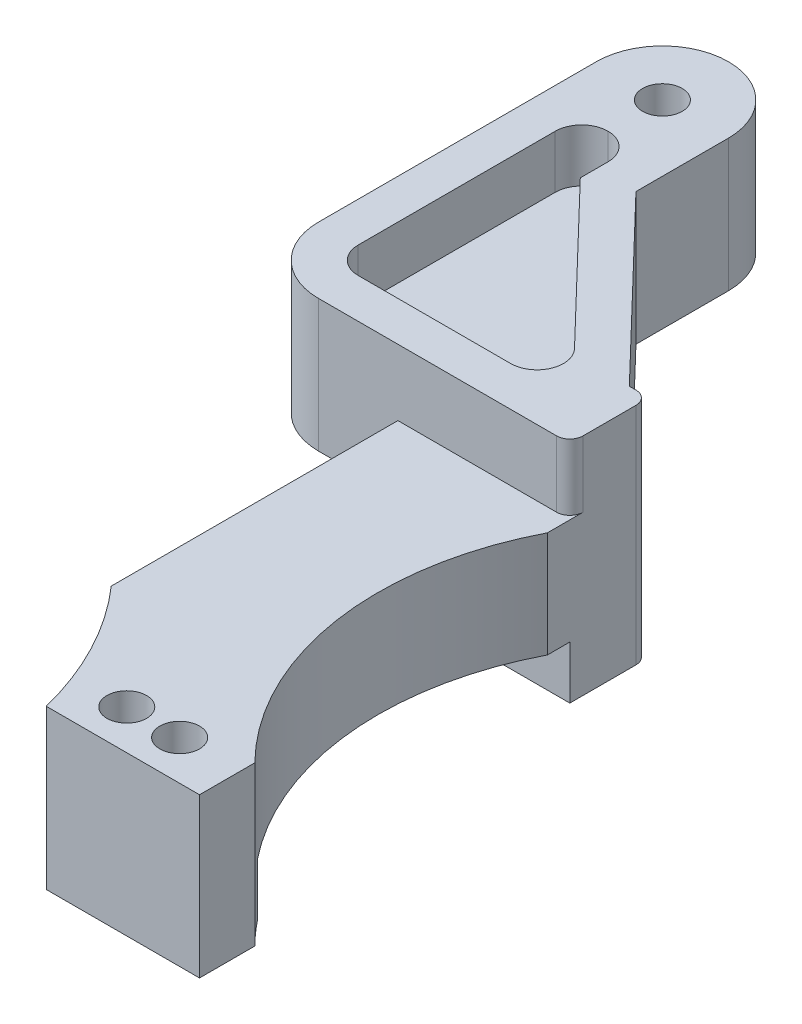
from build123d import *

# Parameters (mm, degrees)
SKETCH1_W             = 13
SKETCH1_H             = 6
SKETCH1_R             = 1.5
BOSS_EXTRUDE1_DEPTH   = 4
BOSS_EXTRUDE1_2_DEPTH = 4
BOSS_EXTRUDE2_START   = 4
SKETCH1_4_R           = 1.5
SKETCH1_4_W           = 13
SKETCH1_4_H           = 6
BOSS_EXTRUDE2_DEPTH   = 8
SKETCH2_R             = 1.5
BOSS_EXTRUDE3_DEPTH   = 5
BOSS_EXTRUDE4_START   = -5
SKETCH2_3_R           = 1.5
BOSS_EXTRUDE4_DEPTH   = 5
CUT_EXTRUDE1_DEPTH    = 4
FILLET1_R             = 1
FILLET2_R             = 1
FILLET3_R             = 2
BOSS_EXTRUDE5_START   = 11
SKETCH4_R             = 1.5
BOSS_EXTRUDE5_DEPTH   = 11


with BuildPart() as part:
    # Sketch1 → Boss-Extrude1 (new body)
    with BuildSketch(Plane(origin=(0, -9, 0), x_dir=(1, 0, 0), z_dir=(0, 1, 0))):
        with Locations((25.1, 41)):
            Rectangle(SKETCH1_W, SKETCH1_H)
        with Locations(Location((27.1, 41, 0), (0, 0, 270))):
            Circle(SKETCH1_R, mode=Mode.SUBTRACT)
        with Locations(Location((23.1, 41, 0), (0, 0, 270))):
            Circle(SKETCH1_R, mode=Mode.SUBTRACT)
    extrude(amount=BOSS_EXTRUDE1_DEPTH)



with BuildPart() as body_2:
    # Sketch1 → Boss-Extrude1 2 (new body)
    with BuildSketch(Plane(origin=(0, -9, 0), x_dir=(1, 0, 0), z_dir=(0, 1, 0))):
        with BuildLine():
            ThreePointArc((22.6, 10.089722494), (23.395394249, 8.075767946), (24.01171589, 6))
            Line((24.01171589, 6), (35.6, 6))
            Line((35.6, 6), (35.6, 10.18070798))
            ThreePointArc((35.6, 10.18070798), (34.768444056, 11.068532406), (33.986085046, 12))
            Line((33.986085046, 12), (31.6, 12))
            Line((31.6, 12), (22.6, 12))
            Line((22.6, 12), (22.6, 10.089722494))
        make_face()
        with Locations(Location((27.1, 9, 0), (0, 0, 270))):
            Circle(SKETCH1_R, mode=Mode.SUBTRACT)
        with Locations(Location((31.1, 9, 0), (0, 0, 270))):
            Circle(SKETCH1_R, mode=Mode.SUBTRACT)
    extrude(amount=BOSS_EXTRUDE1_2_DEPTH)


with BuildPart() as part_1:
    add(part.part)

    add(body_2.part)  # Boss-Extrude2 merges body 2
    # Sketch1<4> → Boss-Extrude2 (add)
    # profile 1 of 5: a face of its own
    with BuildSketch(Plane(origin=(0, -9, 0), x_dir=(1, 0, 0), z_dir=(0, 1, 0)).offset(BOSS_EXTRUDE2_START)):
        with BuildLine():
            ThreePointArc((22.6, 10.089722494), (23.395394249, 8.075767946), (24.01171589, 6))
            Line((24.01171589, 6), (35.6, 6))
            Line((35.6, 6), (35.6, 10.18070798))
            ThreePointArc((35.6, 10.18070798), (34.768444056, 11.068532406), (33.986085046, 12))
            Line((33.986085046, 12), (31.6, 12))
            Line((31.6, 12), (22.6, 12))
            Line((22.6, 12), (22.6, 10.089722494))
        make_face()
        with Locations(Location((27.1, 9, 0), (0, 0, 270))):
            Circle(SKETCH1_4_R, mode=Mode.SUBTRACT)
        with Locations(Location((31.1, 9, 0), (0, 0, 270))):
            Circle(SKETCH1_4_R, mode=Mode.SUBTRACT)
    # profile 2 of 5: a face of its own
    with BuildSketch(Plane(origin=(0, -9, 0), x_dir=(1, 0, 0), z_dir=(0, 1, 0)).offset(BOSS_EXTRUDE2_START)):
        with BuildLine():
            Line((21.646304534, 12), (22.6, 12))
            Line((22.6, 12), (31.6, 12))
            Line((31.6, 12), (31.6, 15.692235936))
            ThreePointArc((31.6, 15.692235936), (29.1, 26), (31.6, 36.307764064))
            Line((31.6, 36.307764064), (31.6, 38))
            Line((31.6, 38), (18.6, 38))
            Line((18.6, 38), (18.6, 16.327966805))
            ThreePointArc((18.6, 16.327966805), (20.239171953, 14.245645604), (21.646304534, 12))
        make_face()
    # profile 3 of 5: a face of its own
    with BuildSketch(Plane(origin=(0, -9, 0), x_dir=(1, 0, 0), z_dir=(0, 1, 0)).offset(BOSS_EXTRUDE2_START)):
        with BuildLine():
            Line((31.6, 15.692235936), (31.6, 12))
            Line((31.6, 12), (33.986085046, 12))
            ThreePointArc((33.986085046, 12), (32.702650951, 13.787702963), (31.6, 15.692235936))
        make_face()
    # profile 4 of 5: a face of its own
    with BuildSketch(Plane(origin=(0, -9, 0), x_dir=(1, 0, 0), z_dir=(0, 1, 0)).offset(BOSS_EXTRUDE2_START)):
        with BuildLine():
            ThreePointArc((21.646304534, 12), (22.143761114, 11.055150099), (22.6, 10.089722494))
            Line((22.6, 10.089722494), (22.6, 12))
            Line((22.6, 12), (21.646304534, 12))
        make_face()
    # profile 5 of 5: a face of its own
    with BuildSketch(Plane(origin=(0, -9, 0), x_dir=(1, 0, 0), z_dir=(0, 1, 0)).offset(BOSS_EXTRUDE2_START)):
        with Locations((25.1, 41)):
            Rectangle(SKETCH1_4_W, SKETCH1_4_H)
        with Locations(Location((27.1, 41, 0), (0, 0, 270))):
            Circle(SKETCH1_4_R, mode=Mode.SUBTRACT)
        with Locations(Location((23.1, 41, 0), (0, 0, 270))):
            Circle(SKETCH1_4_R, mode=Mode.SUBTRACT)
    extrude(amount=BOSS_EXTRUDE2_DEPTH)

    # Sketch2 → Boss-Extrude3 (add)
    with BuildSketch(Plane(origin=(0, 3, 0), x_dir=(1, 0, 0), z_dir=(0, 1, 0))):
        with BuildLine():
            Line((31.6, 38), (31.6, 44))
            Line((31.6, 44), (30.1, 44))
            Line((30.1, 44), (17.6, 57))
            Line((17.6, 57), (17.6, 64))
            ThreePointArc((17.6, 64), (12.6, 69), (7.6, 64))
            Line((7.6, 64), (7.6, 43))
            ThreePointArc((7.6, 43), (9.064466094, 39.464466094), (12.6, 38))
            Line((12.6, 38), (31.6, 38))
        make_face()
        with Locations(Location((12.6, 64, 0), (0, 0, 270))):
            Circle(SKETCH2_R, mode=Mode.SUBTRACT)
    extrude(amount=BOSS_EXTRUDE3_DEPTH)

    # Sketch2<3> → Boss-Extrude4 (add)
    with BuildSketch(Plane(origin=(0, 3, 0), x_dir=(1, 0, 0), z_dir=(0, 1, 0)).offset(BOSS_EXTRUDE4_START)):
        with BuildLine():
            Line((18.6, 38), (18.6, 44))
            Line((18.6, 44), (30.1, 44))
            Line((30.1, 44), (17.6, 57))
            Line((17.6, 57), (17.6, 64))
            ThreePointArc((17.6, 64), (12.6, 69), (7.6, 64))
            Line((7.6, 64), (7.6, 43))
            ThreePointArc((7.6, 43), (9.064466094, 39.464466094), (12.6, 38))
            Line((12.6, 38), (18.6, 38))
        make_face()
        with Locations(Location((12.6, 64, 0), (0, 0, 270))):
            Circle(SKETCH2_3_R, mode=Mode.SUBTRACT)
    extrude(amount=BOSS_EXTRUDE4_DEPTH)

    # Sketch3 → Cut-Extrude1 (cut)
    with BuildSketch(Plane(origin=(0, 8, 0), x_dir=(1, 0, 0), z_dir=(0, 1, 0))):
        with BuildLine():
            Line((10.6, 59.895837344), (14.6, 59.895837344))
            Line((14.6, 59.895837344), (14.6, 55.791674689))
            Line((14.6, 55.791674689), (28.822764124, 41))
            Line((28.822764124, 41), (12.6, 41))
            ThreePointArc((12.6, 41), (11.185786438, 41.585786438), (10.6, 43))
            Line((10.6, 43), (10.6, 59.895837344))
        make_face()
    cut_extrude1 = extrude(amount=-CUT_EXTRUDE1_DEPTH, mode=Mode.SUBTRACT)

    # Fillet1
    fillet1_edges = [part_1.edges().sort_by_distance(p)[0] for p in [
        (31.6, -0.5, -44),
    ]]
    fillet(fillet1_edges, radius=FILLET1_R)

    # Fillet2
    fillet2_edges = [part_1.edges().sort_by_distance(p)[0] for p in [
        (31.6, 5.5, -38),
    ]]
    fillet(fillet2_edges, radius=FILLET2_R)

    # Fillet3
    fillet3_edges = [part_1.edges().sort_by_distance(p)[0] for p in [
        (14.6, 6, -59.895837344),
        (10.6, 6, -59.895837344),
        (28.822764124, 6, -41),
    ]]
    fillet(fillet3_edges, radius=FILLET3_R - 0.0001)  # a hair under: the kernel refuses the full size

    # Mirror2: Cut-Extrude1 across plane
    add(cut_extrude1.mirror(Plane.ZX.offset(3)), mode=Mode.SUBTRACT)

    # Sketch4 → Boss-Extrude5 (add)
    with BuildSketch(Plane.XZ.offset(-2).offset(BOSS_EXTRUDE5_START)):
        with BuildLine():
            Line((18.6, -44), (30.6, -44))
            ThreePointArc((30.6, -44), (31.307106781, -43.707106781), (31.6, -43))
            Line((31.6, -43), (31.6, -38))
            Line((31.6, -38), (18.6, -38))
            Line((18.6, -38), (18.6, -44))
        make_face()
        with Locations(Location((23.1, -41, 0), (0, 0, 90))):
            Circle(SKETCH4_R, mode=Mode.SUBTRACT)
        with Locations(Location((27.1, -41, 0), (0, 0, 90))):
            Circle(SKETCH4_R, mode=Mode.SUBTRACT)
    extrude(amount=-BOSS_EXTRUDE5_DEPTH)


solid = part_1.part
